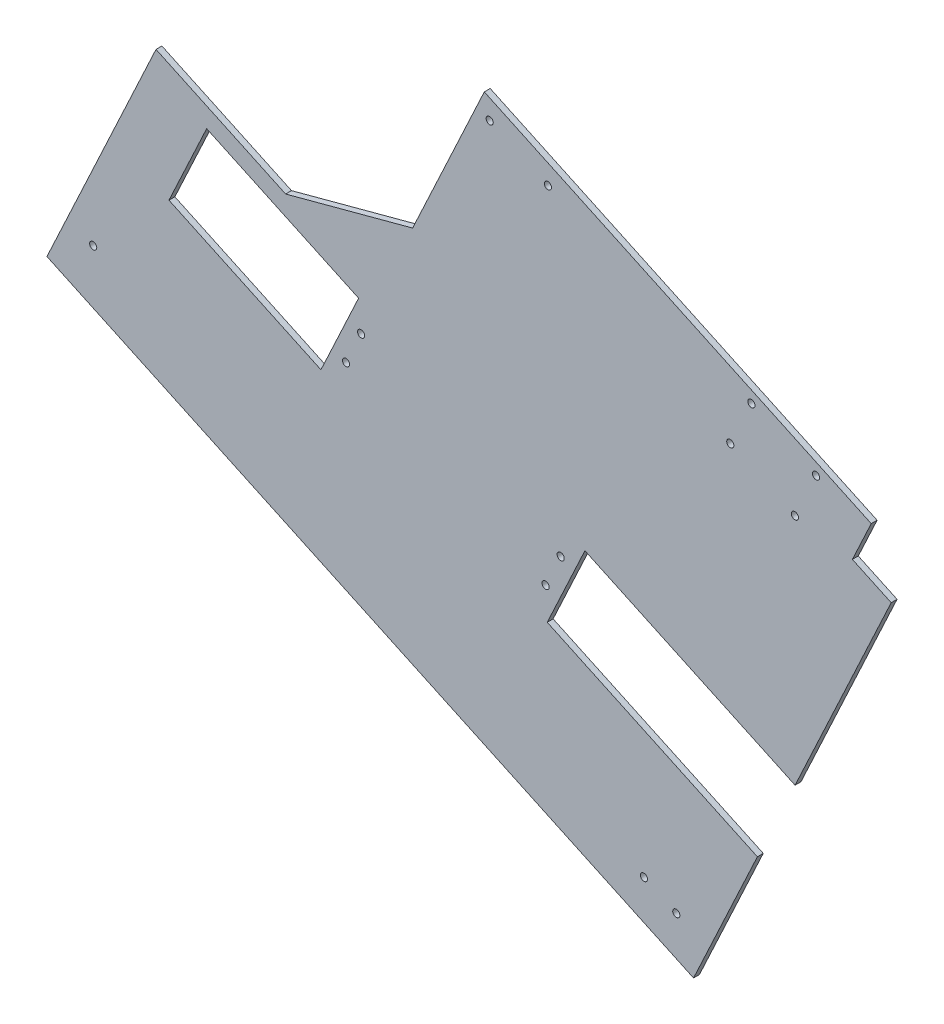
from build123d import *

# Parameters (mm, degrees)
SKETCH1_R           = 2
BOSS_EXTRUDE1_DEPTH = 3.3
SKETCH2_R           = 2
CUT_EXTRUDE1_DEPTH  = 10
CUT_EXTRUDE2_DEPTH  = 10
CUT_EXTRUDE3_DEPTH  = 10
SKETCH7_R           = 2
CUT_EXTRUDE4_DEPTH  = 10


with BuildPart() as part:
    # Sketch1 → Boss-Extrude1 (new body)
    with BuildSketch(Plane.XY):
        Polygon((-271.211712877, -21.678211966), (-332.364575351, -152.820948751), (30.158539464, -321.868253447), (140.969047692, -84.234351686), (119.217660803, -74.091513404), (129.783117347, -51.433818728), (-87.147938799, 49.722794044), (-127.346442995, -36.483176399), (-198.548383588, -55.561678881), align=None)
        with Locations((62.584548297, -26.718878877)):
            Circle(SKETCH1_R, mode=Mode.SUBTRACT)
        with Locations((20.484748958, -295.289732471)):
            Circle(SKETCH1_R, mode=Mode.SUBTRACT)
        with Locations((2.358593217, -286.837367237)):
            Circle(SKETCH1_R, mode=Mode.SUBTRACT)
        with Locations((-306.422910118, -134.574853143)):
            Circle(SKETCH1_R, mode=Mode.SUBTRACT)
        with Locations((50.751236969, -52.095496914)):
            Circle(SKETCH1_R, mode=Mode.SUBTRACT)
        with Locations((87.00354845, -69.000227384)):
            Circle(SKETCH1_R, mode=Mode.SUBTRACT)
        with Locations((98.836859779, -43.623609347)):
            Circle(SKETCH1_R, mode=Mode.SUBTRACT)
    extrude(amount=BOSS_EXTRUDE1_DEPTH)

    # Sketch2 → Cut-Extrude1 (cut)
    with BuildSketch(Plane(origin=(0, 0, 3.3), x_dir=(-1, 0, 0), z_dir=(0, 0, -1))):
        with Locations((51.496578787, 22.064512657)):
            Circle(SKETCH2_R)
        with Locations((84.12365912, 37.27877008)):
            Circle(SKETCH2_R)
    extrude(amount=CUT_EXTRUDE1_DEPTH, mode=Mode.SUBTRACT)

    # Sketch5 → Cut-Extrude2 (cut)
    with BuildSketch(Plane.XY):
        Polygon((65.954306233, -245.103983885), (-51.865706081, -190.163609859), (-30.734792994, -144.848220507), (87.08521932, -199.788594533), align=None)
    extrude(amount=CUT_EXTRUDE2_DEPTH, mode=Mode.SUBTRACT)

    # Sketch6 → Cut-Extrude3 (cut)
    with BuildSketch(Plane.XY.offset(3.3)):
        Polygon((-178.748796266, -130.997053215), (-157.617883179, -85.681663863), (-242.810815161, -45.955547259), (-263.941728248, -91.270936611), align=None)
    extrude(amount=-CUT_EXTRUDE3_DEPTH, mode=Mode.SUBTRACT)

    # Sketch7 → Cut-Extrude4 (cut)
    with BuildSketch(Plane.XY.offset(3.3)):
        with Locations((-52.7985286, -172.571100935)):
            Circle(SKETCH7_R)
        with Locations((-44.346163365, -154.444945194)):
            Circle(SKETCH7_R)
        with Locations((-164.672545808, -120.403389962)):
            Circle(SKETCH7_R)
        with Locations((-156.220180573, -102.277234221)):
            Circle(SKETCH7_R)
    extrude(amount=-CUT_EXTRUDE4_DEPTH, mode=Mode.SUBTRACT)


solid = part.part
